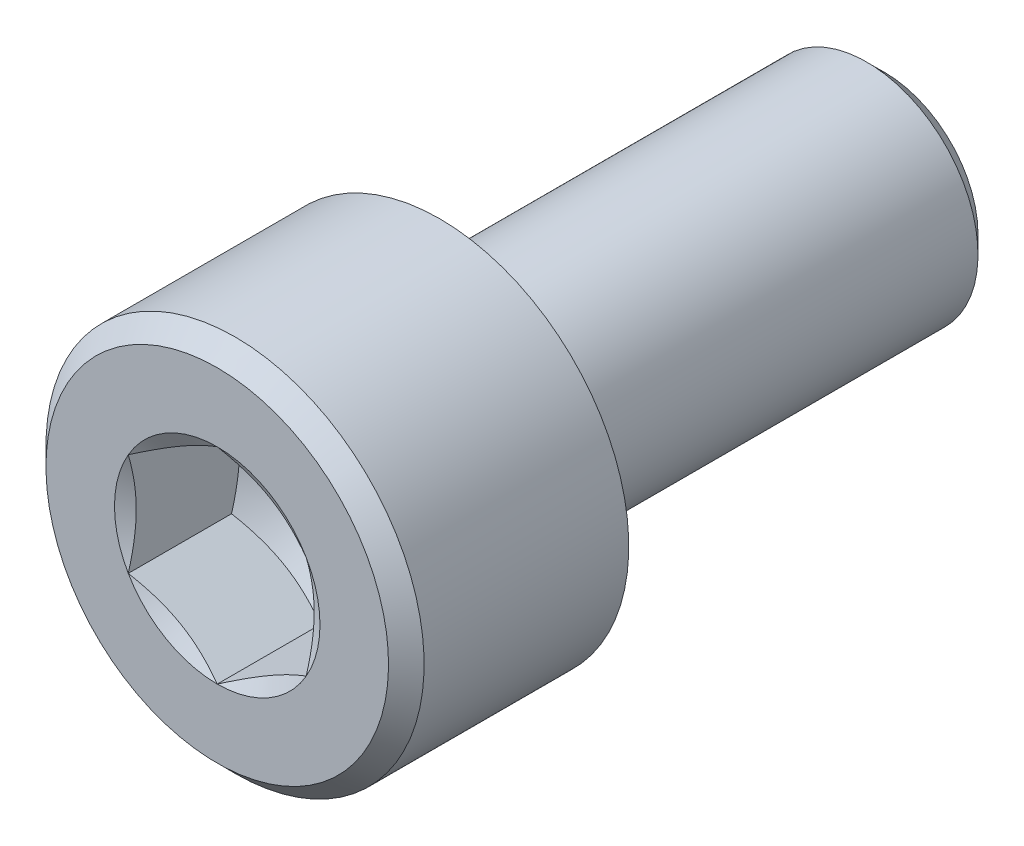
from build123d import *

# Parameters (mm, degrees)
CHAMFER1_SIZE      = 0.4
CUT_EXTRUDE1_REACH = 18.159
FILLET2_R          = 0.2


with BuildPart() as part:
    # Sketch1 → Revolve1 (revolve)
    with BuildSketch(Plane(origin=(0, 0, 0), x_dir=(0, 0, -1), z_dir=(1, 0, 0))):
        Polygon((0, 4.25), (-5, 4.25), (-5, 0), (10, 0), (10, 2.5), (0, 2.5), align=None)
    revolve(axis=Axis((0, 0, 5), (0, 0, -1)))

    # Sketch7 → Cut-Revolve2 (revolve, cut)
    with BuildSketch(Plane(origin=(0, 0, 0), x_dir=(0, 0, -1), z_dir=(1, 0, 0))):
        Polygon((-5, 0), (-5, 2), (-2.5, 2), (-1.345299462, 0), align=None)
    revolve(axis=Axis((0, 0, 5), (0, 0, -1)), mode=Mode.SUBTRACT)

    # Chamfer1
    chamfer1_edges = [part.edges().sort_by_distance(p)[0] for p in [
        (0, -2.5, -10),
        (0, -4.25, 5),
    ]]
    chamfer(chamfer1_edges, length=CHAMFER1_SIZE)

    # Cut-Extrude1: up to this cone (the profile starts inside it)
    cut_extrude1_end = Plane(origin=(0, 0, 5), z_dir=(0, 0, 1)).offset(-3.654699538) * Cone(1.732e-06, 49.612564652, 28.643826557, align=(Align.CENTER, Align.CENTER, Align.MIN), mode=Mode.PRIVATE)
    # Sketch8 → Cut-Extrude1 (cut, up to the surface)
    with BuildSketch(Plane.XY.offset(5), mode=Mode.PRIVATE) as cut_extrude1_sk1:
        Polygon((0, 2.309401077), (-2, 1.154700538), (-2, -1.154700538), (0, -2.309401077), (2, -1.154700538), (2, 1.154700538), align=None)
    cut_extrude1_tool1 = extrude(cut_extrude1_sk1.sketch, amount=-CUT_EXTRUDE1_REACH, mode=Mode.PRIVATE) & cut_extrude1_end
    add(cut_extrude1_tool1.solids().sort_by_distance((0, 0, 5))[0], mode=Mode.SUBTRACT)

    # Sketch9 → Cut-Revolve3 (revolve, cut)
    with BuildSketch(Plane(origin=(0, 0, 0), x_dir=(0, 0, -1), z_dir=(1, 0, 0))):
        Polygon((-5.5, 3.175426481), (-5.5, 2), (-4.821367205, 2), align=None)
    revolve(axis=Axis((0, 0, 5), (0, 0, -1)), mode=Mode.SUBTRACT)

    # Fillet2
    fillet2_edges = [part.edges().sort_by_distance(p)[0] for p in [
        (0, -2.5, 0),
    ]]
    fillet(fillet2_edges, radius=FILLET2_R)


solid = part.part
